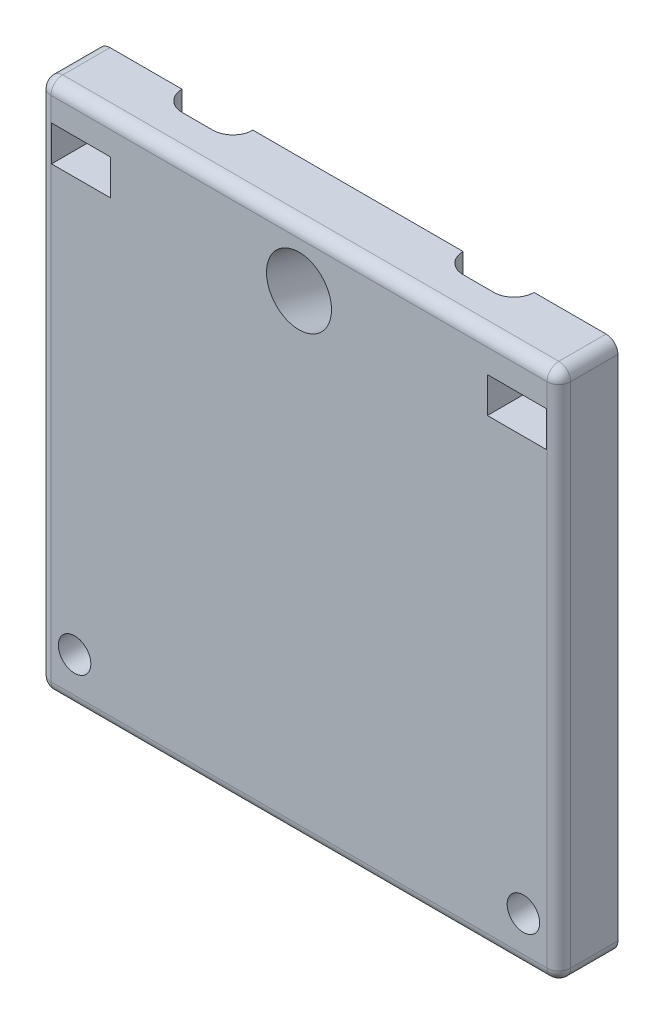
from build123d import *

# Parameters (mm, degrees)
SKETCH1_W                       = 44
SKETCH1_H                       = 45
BASE_DEPTH                      = 5
WIRE_GROOVES_DEPTH              = 51.338851795
SCREW_INSERTION_HOLE_DEPTH      = 33.181634738
SCREW_INSERTION_HOLE_DEPTH_BACK = 33.181634738
SKETCH3_R                       = 2.75
SKETCH5_W                       = 5
SKETCH5_H                       = 3
ZIP_TIE_SLOTS_DEPTH             = 32.862987933
SKETCH6_R                       = 1.375
MOUNT_CLAMPING_HOLES_DEPTH      = 32.862987933
EDGE_FILLETS_R                  = 1


with BuildPart() as part:
    # Sketch1 → Base (new body)
    with BuildSketch(Plane.XY):
        Rectangle(SKETCH1_W, SKETCH1_H)
    extrude(amount=BASE_DEPTH)

    # Sketch2 → Wire Grooves (cut, through all)
    with BuildSketch(Plane(origin=(0, 22.5, 0), x_dir=(1, 0, 0), z_dir=(0, 1, 0))):
        with BuildLine():
            Line((-14.9, 0), (-8.9, 0))
            ThreePointArc((-8.9, 0), (-9.397918472, -1.202081528), (-10.6, -1.7))
            Line((-10.6, -1.7), (-13.2, -1.7))
            ThreePointArc((-13.2, -1.7), (-14.402081528, -1.202081528), (-14.9, 0))
        make_face()
        with BuildLine():
            Line((13.2, -1.7), (10.6, -1.7))
            ThreePointArc((10.6, -1.7), (9.397918472, -1.202081528), (8.9, 0))
            Line((8.9, 0), (14.9, 0))
            ThreePointArc((14.9, 0), (14.402081528, -1.202081528), (13.2, -1.7))
        make_face()
    extrude(amount=-WIRE_GROOVES_DEPTH, mode=Mode.SUBTRACT)

    # Sketch3 → Screw Insertion Hole (cut, two sides: drawn at the far end of the back side and taken through both)
    with BuildSketch(Plane(origin=(0, 0.596130014, 4.269237963), x_dir=(-1, 0, 0), z_dir=(0, -0.25881904510252135, -0.9659258262890681)).offset(-SCREW_INSERTION_HOLE_DEPTH_BACK)):
        with Locations((0, 16.291616808)):
            Circle(SKETCH3_R)
    extrude(amount=SCREW_INSERTION_HOLE_DEPTH + SCREW_INSERTION_HOLE_DEPTH_BACK, mode=Mode.SUBTRACT)

    # Sketch5 → Zip Tie Slots (cut, through all)
    with BuildSketch(Plane(origin=(0, 0, 0), x_dir=(-1, 0, 0), z_dir=(0, 0, -1))):
        with Locations((-18.45, 18)):
            Rectangle(SKETCH5_W, SKETCH5_H)
        with Locations((18.45, 18)):
            Rectangle(SKETCH5_W, SKETCH5_H)
    extrude(amount=-ZIP_TIE_SLOTS_DEPTH, mode=Mode.SUBTRACT)

    # Sketch6 → Mount Clamping Holes (cut, through all)
    with BuildSketch(Plane(origin=(0, 0, 0), x_dir=(-1, 0, 0), z_dir=(0, 0, -1))):
        with Locations((-19, -18.5)):
            Circle(SKETCH6_R)
        with Locations((19, -18.5)):
            Circle(SKETCH6_R)
    extrude(amount=-MOUNT_CLAMPING_HOLES_DEPTH, mode=Mode.SUBTRACT)

    # Edge Fillets
    edge_fillets_edges = [part.edges().sort_by_distance(p)[0] for p in [
        (-22, 0, 5),
        (22, 0, 5),
        (0, -22.5, 5),
        (0, 22.5, 5),
        (22, 22.5, 2.5),
        (22, -22.5, 2.5),
        (-22, -22.5, 2.5),
        (-22, 22.5, 2.5),
    ]]
    fillet(edge_fillets_edges, radius=EDGE_FILLETS_R)


solid = part.part
